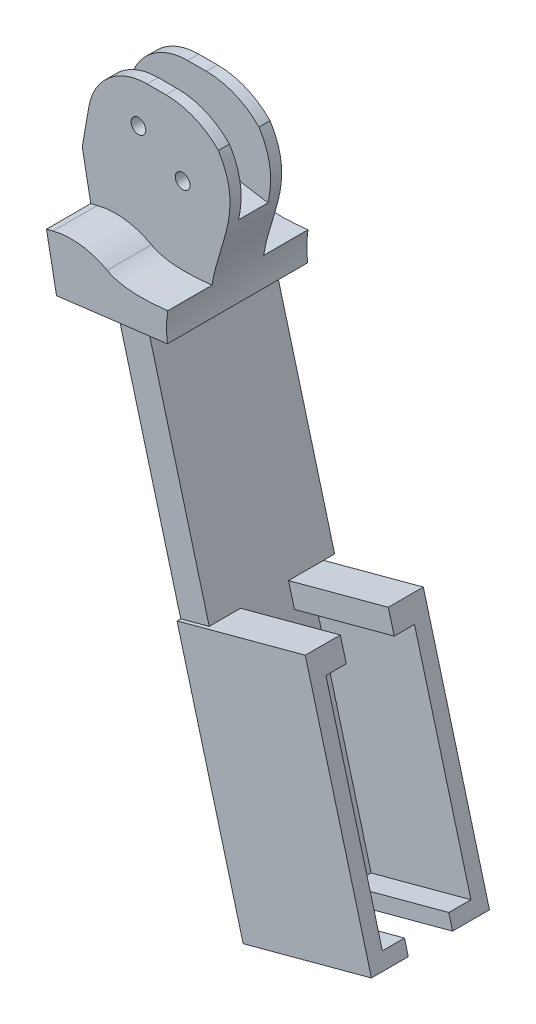
from build123d import *

# Parameters (mm, degrees)
SKETCH10_R                = 1
BOSS_EXTRUDE5_DEPTH       = 7.5
CUT_EXTRUDE1_DEPTH        = 4
FILLET1_R                 = 10
CUT_EXTRUDE6_START        = -11
CUT_EXTRUDE6_DEPTH        = 10
CUT_EXTRUDE7_DEPTH        = 2
BOSS_EXTRUDE11_DEPTH      = 9
BOSS_EXTRUDE13_DEPTH      = 64
BOSS_EXTRUDE13_DEPTH_BACK = 3
SKETCH30_W                = 4
SKETCH30_H                = 15
BOSS_EXTRUDE14_DEPTH      = 14
BOSS_EXTRUDE14_DEPTH_BACK = 4
CUT_EXTRUDE9_DEPTH        = 9
FILLET2_R                 = 8
FILLET3_R                 = 10
BOSS_EXTRUDE15_DEPTH      = 2
BOSS_EXTRUDE16_START      = 2
BOSS_EXTRUDE16_DEPTH      = 2
CUT_EXTRUDE10_DEPTH       = 28


with BuildPart() as part:
    # Sketch10 → Boss-Extrude5 (new, symmetric)
    with BuildSketch(Plane.XY):
        Polygon((27.048887868, 48.656944563), (33.959433176, 37.989988632), (36.993816658, 26.682834617), (12.788755024, 23.658848526), (10.279677841, 36.875809012), (12.321789019, 48.656944563), align=None)
        with Locations((17.890076876, 43.12952492)):
            Circle(SKETCH10_R, mode=Mode.SUBTRACT)
        with Locations((23.882298789, 39.668364252)):
            Circle(SKETCH10_R, mode=Mode.SUBTRACT)
    extrude(amount=BOSS_EXTRUDE5_DEPTH, both=True)

    # Sketch11 → Cut-Extrude1 (cut)
    with BuildSketch(Plane.XY.offset(7.5)):
        with BuildLine():
            Line((17.825431655, 32.423947427), (9.123881611, 30.207909529))
            Line((9.123881611, 30.207909529), (6.594316119, 53.15991455))
            Line((6.594316119, 53.15991455), (34.693470887, 60.271659822))
            Line((34.693470887, 60.271659822), (37.752907488, 30.846026516))
            add(Edge.make_bspline(
                [(37.752907488, 30.846026516), (30.679137573, 30.15507536), (19.269012528, 26.734198276), (17.825431655, 32.423947427)],
                knots=[0, 0, 0, 0, 1, 1, 1, 1], degree=3))
        make_face()
    extrude(amount=-CUT_EXTRUDE1_DEPTH, mode=Mode.SUBTRACT)

    # Fillet1
    fillet1_edges = [part.edges().sort_by_distance(p)[0] for p in [
        (27.048887868, 48.656944563, -2),
    ]]
    fillet(fillet1_edges, radius=FILLET1_R)

    # Sketch11<2> → Cut-Extrude6 (cut)
    with BuildSketch(Plane.XY.offset(7.5).offset(CUT_EXTRUDE6_START)):
        with BuildLine():
            Line((17.825431655, 32.423947427), (9.123881611, 30.207909529))
            Line((9.123881611, 30.207909529), (6.594316119, 53.15991455))
            Line((6.594316119, 53.15991455), (34.693470887, 60.271659822))
            Line((34.693470887, 60.271659822), (37.752907488, 30.846026516))
            add(Edge.make_bspline(
                [(37.752907488, 30.846026516), (30.679137573, 30.15507536), (19.269012528, 26.734198276), (17.825431655, 32.423947427)],
                knots=[0, 0, 0, 0, 1, 1, 1, 1], degree=3))
        make_face()
    extrude(amount=-CUT_EXTRUDE6_DEPTH, mode=Mode.SUBTRACT)

    # Sketch16 → Cut-Extrude7 (cut, symmetric)
    with BuildSketch(Plane.XY):
        Polygon((10.074284509, 54.36084815), (34.418624568, 54.36084815), (34.418624568, 36.664364271), (10.074284509, 40.645108775), align=None)
    extrude(amount=CUT_EXTRUDE7_DEPTH, both=True, mode=Mode.SUBTRACT)

    # Sketch26 → Boss-Extrude11 (add)
    with BuildSketch(Plane(origin=(41.188168375, 11.053240949, 0), x_dir=(0, 0, -1), z_dir=(0.9658266565657433, 0.2591888683316433, 0))):
        Polygon((2, 27.88983665), (2, 26.535626274), (-2, 26.535626274), (-2, 27.88983665), (-3.5, 27.88983665), (-3.5, 20.267140373), (-7.5, 20.267140373), (-7.5, 16.182607471), (7.5, 16.182607471), (7.5, 20.267140372), (3.5, 20.267140373), (3.5, 27.88983665), align=None)
    extrude(amount=BOSS_EXTRUDE11_DEPTH)

    # Sketch30 → Boss-Extrude13 (add, two sides: drawn at the far end of the back side and taken through both)
    with BuildSketch(Plane(origin=(-4.194351717, 15.629593668, 0), x_dir=(0.9658266565657433, 0.25918886833164334, 0), z_dir=(0.25918886833164334, -0.9658266565657433, 0)).offset(-BOSS_EXTRUDE13_DEPTH_BACK)):
        with Locations((26.645507965, 0)):
            Rectangle(SKETCH30_W, SKETCH30_H)
    extrude(amount=BOSS_EXTRUDE13_DEPTH + BOSS_EXTRUDE13_DEPTH_BACK)

    # Sketch31 → Boss-Extrude14 (add, two sides: drawn at the far end of the back side and taken through both)
    with BuildSketch(Plane(origin=(27.666595183, 7.424596792, 0), x_dir=(0, 0, -1), z_dir=(0.9658266565657432, 0.2591888683316434, 0)).offset(-BOSS_EXTRUDE14_DEPTH_BACK)):
        Polygon((-3.25, -14.731166129), (-8, -14.731166129), (-8, -49.317392529), (-3, -49.317392529), (-3, -47.317392529), (-6, -47.317392529), (-6, -17.817392529), (-3.25, -17.817392529), align=None)
        Polygon((3, -47.317392529), (3, -49.317392529), (8, -49.317392529), (8, -14.731166129), (3.25, -14.731166129), (3.25, -17.817392529), (6, -17.817392529), (6, -47.317392529), align=None)
    extrude(amount=BOSS_EXTRUDE14_DEPTH + BOSS_EXTRUDE14_DEPTH_BACK)

    # Sketch32 → Cut-Extrude9 (cut)
    with BuildSketch(Plane(origin=(49.880608284, 13.385940764, 0), x_dir=(0, 0, -1), z_dir=(0.9658266565657431, 0.25918886833164445, 0))):
        Polygon((3.5, 27.88983665), (2, 27.88983665), (2, 26.535626274), (-2, 26.535626274), (-2, 27.88983665), (-3.5, 27.88983665), (-3.5, 20.267140373), (-7.5, 20.267140373), (-7.5, 16.182607471), (7.5, 16.182607471), (7.5, 20.267140372), (3.5, 20.267140373), align=None)
    extrude(amount=-CUT_EXTRUDE9_DEPTH, mode=Mode.SUBTRACT)

    # Fillet2
    fillet2_edges = [part.edges().sort_by_distance(p)[0] for p in [
        (12.321789019, 48.656944563, 2.75),
        (12.321789019, 48.656944563, -2.75),
    ]]
    fillet(fillet2_edges, radius=FILLET2_R)

    # Fillet3
    fillet3_edges = [part.edges().sort_by_distance(p)[0] for p in [
        (17.825431655, 32.423947427, 5.5),
        (17.825431655, 32.423947427, -5.5),
    ]]
    fillet(fillet3_edges, radius=FILLET3_R)

    # Sketch33 → Boss-Extrude15 (add)
    with BuildSketch(Plane(origin=(0, 0, -7.5), x_dir=(-1, 0, 0), z_dir=(0, 0, -1))):
        with BuildLine():
            Line((-12.788755024, 23.658848526), (-11.433819556, 30.796185182))
            Line((-11.433819556, 30.796185182), (-12.326379112, 31.023494775))
            ThreePointArc((-12.326379112, 31.023494775), (-16.080268918, 31.249787506), (-19.652288318, 30.073533078))
            add(Edge.make_bspline(
                [(-19.652288318, 30.073533078), (-23.094178016, 28.160579122), (-30.349802092, 29.858629099), (-35.935151197, 30.627785373)],
                knots=[0.191604014, 0.191604014, 0.191604014, 0.191604014, 0.918085752, 0.918085752, 0.918085752, 0.918085752], degree=3))
            Line((-35.935151197, 30.627785373), (-36.993816658, 26.682834617))
            Line((-36.993816658, 26.682834617), (-22.968678464, 24.93064644))
            Line((-22.968678464, 24.93064644), (-31.484749461, -6.803156137))
            Line((-31.484749461, -6.803156137), (-27.621442835, -7.839911611))
            Line((-27.621442835, -7.839911611), (-18.961496124, 24.430021246))
            Line((-18.961496124, 24.430021246), (-12.788755024, 23.658848526))
        make_face()
    extrude(amount=BOSS_EXTRUDE15_DEPTH)

    # Sketch34 → Boss-Extrude16 (add)
    with BuildSketch(Plane.XY.offset(7.5).offset(BOSS_EXTRUDE16_START)):
        with BuildLine():
            Line((12.326379112, 31.023494775), (11.433819556, 30.796185182))
            Line((11.433819556, 30.796185182), (12.788755024, 23.658848526))
            Line((12.788755024, 23.658848526), (22.968678464, 24.93064644))
            Line((22.968678464, 24.93064644), (36.993816658, 26.682834617))
            Line((36.993816658, 26.682834617), (35.935151197, 30.627785373))
            add(Edge.make_bspline(
                [(35.935151197, 30.627785373), (30.349802091, 29.858629099), (23.094178016, 28.160579122), (19.652288318, 30.073533078)],
                knots=[0.191604014, 0.191604014, 0.191604014, 0.191604014, 0.918085752, 0.918085752, 0.918085752, 0.918085752], degree=3))
            ThreePointArc((19.652288318, 30.073533078), (16.080268918, 31.249787506), (12.326379112, 31.023494775))
        make_face()
    extrude(amount=-BOSS_EXTRUDE16_DEPTH)

    # Sketch36 → Cut-Extrude10 (cut)
    with BuildSketch(Plane.XY.offset(9.5)):
        with BuildLine():
            Line((28.735168536, 45.675741107), (43.151621949, 50.021353904))
            Line((43.151621949, 50.021353904), (48.709339966, 19.453904806))
            Line((48.709339966, 19.453904806), (40.633280972, 13.201472036))
            add(Edge.make_bspline(
                [(28.735168536, 45.675741107), (36.204474426, 33.608717883), (15.102513827, 27.616803145), (34.98872361, 13.201472036), (40.633280972, 13.201472036)],
                knots=[0, 0, 0, 0, 0, 1, 1, 1, 1, 1], degree=4))
        make_face()
    extrude(amount=-CUT_EXTRUDE10_DEPTH, mode=Mode.SUBTRACT)


solid = part.part
